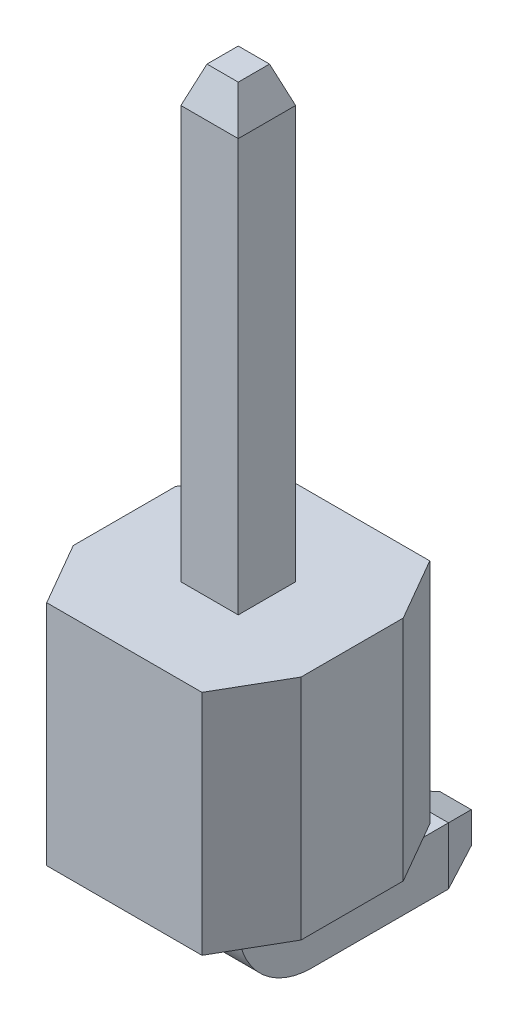
from build123d import *
from OCP.BRepFilletAPI import BRepFilletAPI_MakeChamfer

# Parameters (mm, degrees)
SKETCH2_W      = 0.64
SKETCH2_H      = 0.64
CHAMFER1_SIZE  = 0.4
CHAMFER1_SIZE2 = 0.145588094
SKETCH6_W      = 2.54
SKETCH6_H      = 2.54
EXTRUDE1_DEPTH = 2.54
CHAMFER2_SIZE  = 0.7
CHAMFER2_SIZE2 = 0.404145188


with BuildPart() as part:
    # Sweep1: sweep along a path in Sketch1
    with BuildLine(Plane(origin=(0, 0, 0), x_dir=(0, 0, -1), z_dir=(1, 0, 0))) as sweep1_path:
        Line((0, -5.359515774), (-1.924260195, -5.359515774))
        ThreePointArc((-1.924260195, -5.359515774), (-2.277813586, -5.213069164), (-2.424260195, -4.859515774))
        Line((-2.424260195, -4.859515774), (-2.424260195, 3.140484226))
    # Sketch2 → Sweep1 (sweep)
    with BuildSketch(Plane.XY):
        with Locations((0, -5.359515774)):
            Rectangle(SKETCH2_W, SKETCH2_H)
    sweep(path=sweep1_path.line)

    # Chamfer1: one chamfer whose edges measure the first distance from different faces: ONE call of the kernel's chamfer builder (chamfer() names one face for all edges)
    chamfer1_edges_1 = [part.edges().sort_by_distance(p)[0] for p in [
        (0, -5.679515774, 0),
    ]]
    chamfer1_side_1 = [part.faces().sort_by_distance(p)[0] for p in [
        (0, -5.679515774, 0.962130097),
    ]]
    chamfer1_edges_2 = [part.edges().sort_by_distance(p)[0] for p in [
        (0.32, -5.359515774, 0),
        (0.32, 3.140484226, 2.424260195),
    ]]
    chamfer1_side_2 = [part.faces().sort_by_distance(p)[0] for p in [
        (0.32, -1.987926827, 2.15141447),
    ]]
    chamfer1_edges_3 = [part.edges().sort_by_distance(p)[0] for p in [
        (0, -5.039515774, 0),
    ]]
    chamfer1_side_3 = [part.faces().sort_by_distance(p)[0] for p in [
        (0, -5.039515774, 0.962130097),
    ]]
    chamfer1_edges_4 = [part.edges().sort_by_distance(p)[0] for p in [
        (-0.32, -5.359515774, 0),
        (-0.32, 3.140484226, 2.424260195),
    ]]
    chamfer1_side_4 = [part.faces().sort_by_distance(p)[0] for p in [
        (-0.32, -1.987926827, 2.15141447),
    ]]
    chamfer1_edges_5 = [part.edges().sort_by_distance(p)[0] for p in [
        (0, 3.140484226, 2.104260195),
    ]]
    chamfer1_side_5 = [part.faces().sort_by_distance(p)[0] for p in [
        (0, -0.859515774, 2.104260195),
    ]]
    chamfer1_edges_6 = [part.edges().sort_by_distance(p)[0] for p in [
        (0, 3.140484226, 2.744260195),
    ]]
    chamfer1_side_6 = [part.faces().sort_by_distance(p)[0] for p in [
        (0, -0.859515774, 2.744260195),
    ]]
    chamfer1 = BRepFilletAPI_MakeChamfer(part.part.solid().wrapped)
    for e in chamfer1_edges_1:
        chamfer1.Add(CHAMFER1_SIZE, CHAMFER1_SIZE2, e.wrapped, chamfer1_side_1[0].wrapped)  # the first distance lies on this face
    for e in chamfer1_edges_2:
        chamfer1.Add(CHAMFER1_SIZE, CHAMFER1_SIZE2, e.wrapped, chamfer1_side_2[0].wrapped)  # the first distance lies on this face
    for e in chamfer1_edges_3:
        chamfer1.Add(CHAMFER1_SIZE, CHAMFER1_SIZE2, e.wrapped, chamfer1_side_3[0].wrapped)  # the first distance lies on this face
    for e in chamfer1_edges_4:
        chamfer1.Add(CHAMFER1_SIZE, CHAMFER1_SIZE2, e.wrapped, chamfer1_side_4[0].wrapped)  # the first distance lies on this face
    for e in chamfer1_edges_5:
        chamfer1.Add(CHAMFER1_SIZE, CHAMFER1_SIZE2, e.wrapped, chamfer1_side_5[0].wrapped)  # the first distance lies on this face
    for e in chamfer1_edges_6:
        chamfer1.Add(CHAMFER1_SIZE, CHAMFER1_SIZE2, e.wrapped, chamfer1_side_6[0].wrapped)  # the first distance lies on this face
    add(Compound.cast(chamfer1.Shape()), mode=Mode.REPLACE)


with BuildPart() as body_2:
    # Sketch6 → Extrude1 (new body)
    with BuildSketch(Plane(origin=(0, -4.399515774, 0), x_dir=(-1, 0, 0), z_dir=(0, 1, 0))):
        with Locations((0, 2.424260195)):
            Rectangle(SKETCH6_W, SKETCH6_H)
    extrude(amount=EXTRUDE1_DEPTH)

    # Chamfer2: one chamfer whose edges measure the first distance from different faces: ONE call of the kernel's chamfer builder (chamfer() names one face for all edges)
    chamfer2_edges_1 = [body_2.edges().sort_by_distance(p)[0] for p in [
        (-1.27, -3.129515774, 3.694260195),
        (-1.27, -3.129515774, 1.154260195),
    ]]
    chamfer2_side_1 = [body_2.faces().sort_by_distance(p)[0] for p in [
        (-1.27, -3.129515774, 2.424260195),
    ]]
    chamfer2_edges_2 = [body_2.edges().sort_by_distance(p)[0] for p in [
        (1.27, -3.129515774, 3.694260195),
        (1.27, -3.129515774, 1.154260195),
    ]]
    chamfer2_side_2 = [body_2.faces().sort_by_distance(p)[0] for p in [
        (1.27, -3.129515774, 2.424260195),
    ]]
    chamfer2 = BRepFilletAPI_MakeChamfer(body_2.part.solid().wrapped)
    for e in chamfer2_edges_1:
        chamfer2.Add(CHAMFER2_SIZE, CHAMFER2_SIZE2, e.wrapped, chamfer2_side_1[0].wrapped)  # the first distance lies on this face
    for e in chamfer2_edges_2:
        chamfer2.Add(CHAMFER2_SIZE, CHAMFER2_SIZE2, e.wrapped, chamfer2_side_2[0].wrapped)  # the first distance lies on this face
    add(Compound.cast(chamfer2.Shape()), mode=Mode.REPLACE)


solid = Compound([part.part, body_2.part])
